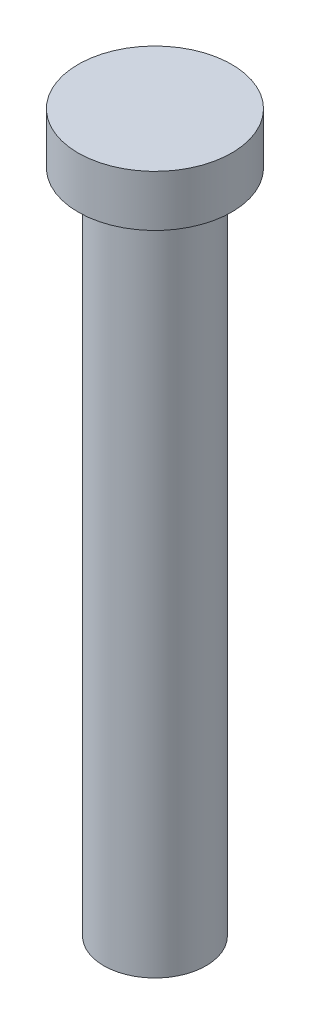
from build123d import *


with BuildPart() as part:
    # 스케치1 → 회전1 (revolve)
    with BuildSketch(Plane(origin=(0, 0, 0), x_dir=(0, 0, -1), z_dir=(1, 0, 0))):
        Polygon((0, 16.246180973), (3, 16.246180973), (3, 14.246180973), (2, 14.246180973), (2, -11.753819027), (0, -11.753819027), align=None)
    revolve(axis=Axis((0, 20.990482646, 0), (0, -1, 0)))


solid = part.part
